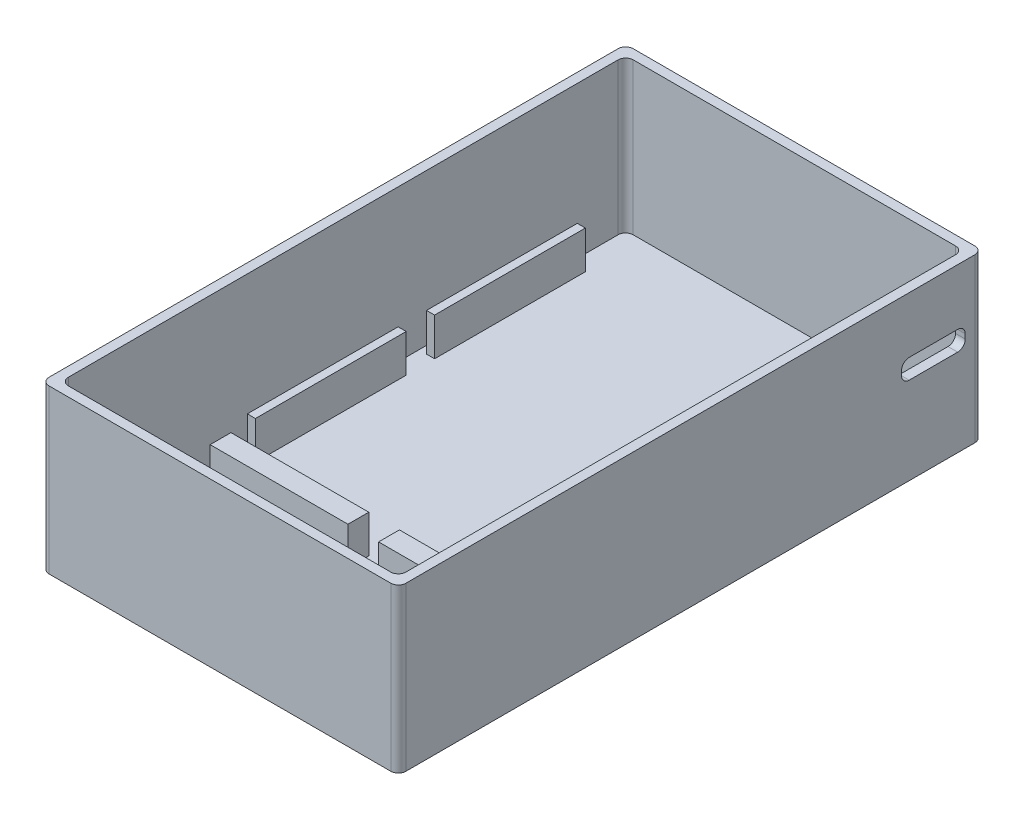
from build123d import *

# Parameters (mm, degrees)
SKETCH1_W           = 47.09116882
SKETCH1_H           = 77.09116882
BOSS_EXTRUDE1_DEPTH = 1.5
SKETCH2_W           = 47.09116882
SKETCH2_H           = 77.09116882
SKETCH2_W_2         = 44.545584412
SKETCH2_H_2         = 74.545584412
BOSS_EXTRUDE2_DEPTH = 20
FILLET4_R           = 1
CUT_EXTRUDE4_DEPTH  = 2
FILLET5_R           = 1
SKETCH10_W          = 18.187450175
SKETCH10_H          = 2.746977624
SKETCH10_W_2        = 18.187450176
SKETCH10_W_3        = 1.062839991
SKETCH10_H_2        = 19.895622202
SKETCH10_W_4        = 1.06283999
BOSS_EXTRUDE4_DEPTH = 5


with BuildPart() as part:
    # Sketch1 → Boss-Extrude1 (new body)
    with BuildSketch(Plane(origin=(0, 0, 0), x_dir=(1, 0, 0), z_dir=(0, 1, 0))):
        with Locations((23.54558441, -38.54558441)):
            Rectangle(SKETCH1_W, SKETCH1_H)
    extrude(amount=BOSS_EXTRUDE1_DEPTH)

    # Sketch2 → Boss-Extrude2 (add)
    with BuildSketch(Plane(origin=(0, 1.5, 0), x_dir=(1, 0, 0), z_dir=(0, 1, 0))):
        with Locations((23.54558441, -38.54558441)):
            Rectangle(SKETCH2_W, SKETCH2_H)
        with Locations((23.545584412, -38.545584412)):
            Rectangle(SKETCH2_W_2, SKETCH2_H_2, mode=Mode.SUBTRACT)
    extrude(amount=BOSS_EXTRUDE2_DEPTH)

    # Fillet4
    fillet4_edges = [part.edges().sort_by_distance(p)[0] for p in [
        (45.818376618, 11.5, 1.272792206),
        (1.272792206, 11.5, 1.272792206),
        (45.818376618, 11.5, 75.818376618),
        (1.272792206, 11.5, 75.818376618),
        (47.09116882, 10.75, 0),
        (0, 10.75, 0),
        (47.09116882, 10.75, 77.09116882),
        (0, 10.75, 77.09116882),
    ]]
    fillet(fillet4_edges, radius=FILLET4_R)

    # Sketch9 → Cut-Extrude4 (cut)
    with BuildSketch(Plane(origin=(47.09116882, 0, 0), x_dir=(0, 0, -1), z_dir=(1, 0, 0))):
        Polygon((-10.672792206, 14.1), (-10.672792206, 11.5), (-10.310591422, 11.5), (-2.272792206, 11.5), (-2.272792206, 14.1), align=None)
    extrude(amount=-CUT_EXTRUDE4_DEPTH, mode=Mode.SUBTRACT)

    # Fillet5
    fillet5_edges = [part.edges().sort_by_distance(p)[0] for p in [
        (46.454772719, 14.1, 10.672792206),
        (46.454772719, 11.5, 2.272792206),
        (46.454772719, 14.1, 2.272792206),
        (46.454772719, 11.5, 10.672792206),
    ]]
    fillet(fillet5_edges, radius=FILLET5_R)

    # Sketch10 → Boss-Extrude4 (add)
    with BuildSketch(Plane(origin=(0, 1.5, 0), x_dir=(1, 0, 0), z_dir=(0, 1, 0))):
        with Locations((12.429357284, -56.800841985)):
            Rectangle(SKETCH10_W, SKETCH10_H)
        with Locations((34.66181154, -56.800841985)):
            Rectangle(SKETCH10_W_2, SKETCH10_H)
        with Locations((2.804212202, -42.251488371)):
            Rectangle(SKETCH10_W_3, SKETCH10_H_2)
        with Locations((2.804212202, -18.603217976)):
            Rectangle(SKETCH10_W_3, SKETCH10_H_2)
        with Locations((44.286956623, -18.603217976)):
            Rectangle(SKETCH10_W_4, SKETCH10_H_2)
        with Locations((44.286956623, -42.251488371)):
            Rectangle(SKETCH10_W_4, SKETCH10_H_2)
    extrude(amount=BOSS_EXTRUDE4_DEPTH)


solid = part.part
